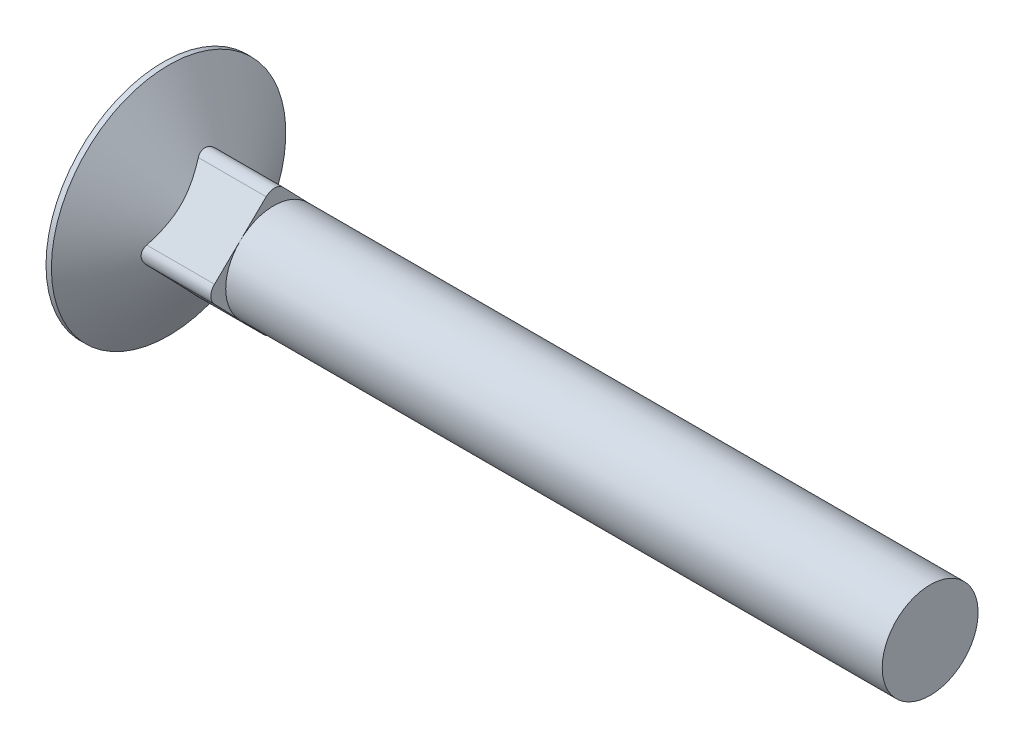
from build123d import *

# Parameters (mm, degrees)
NECK_DEPTH = 10.9728


# Read off the part's stored shape, not the designer's step: Cut-Revolve1
with BuildPart() as part:
    # Cut-Revolve1 outline → Cut-Revolve1 (revolve)
    with BuildSketch(Plane.YX):
        Polygon((0, 76.2), (0, 0), (11.6459, 0), (11.6459, 0.533667773), (4.7625, 5.0038), (4.7625, 76.2), align=None)
    revolve(axis=Axis((0, 0, 0), (1, 0, 0)))

    # Sketch2 → Neck (add)
    with BuildSketch(Plane(origin=(0, 0, 0), x_dir=(0, 0.6946583704589985, -0.7193398003386501), z_dir=(1, 0, 0))):
        with BuildLine():
            Line((3.5687, -4.7625), (-3.5687, -4.7625))
            ThreePointArc((-3.5687, -4.7625), (-4.412844075, -4.412844075), (-4.7625, -3.5687))
            Line((-4.7625, -3.5687), (-4.7625, 3.5687))
            ThreePointArc((-4.7625, 3.5687), (-4.412844075, 4.412844075), (-3.5687, 4.7625))
            Line((-3.5687, 4.7625), (3.5687, 4.7625))
            ThreePointArc((3.5687, 4.7625), (4.412844075, 4.412844075), (4.7625, 3.5687))
            Line((4.7625, 3.5687), (4.7625, -3.5687))
            ThreePointArc((4.7625, -3.5687), (4.412844075, -4.412844075), (3.5687, -4.7625))
        make_face()
    extrude(amount=NECK_DEPTH)


solid = part.part
